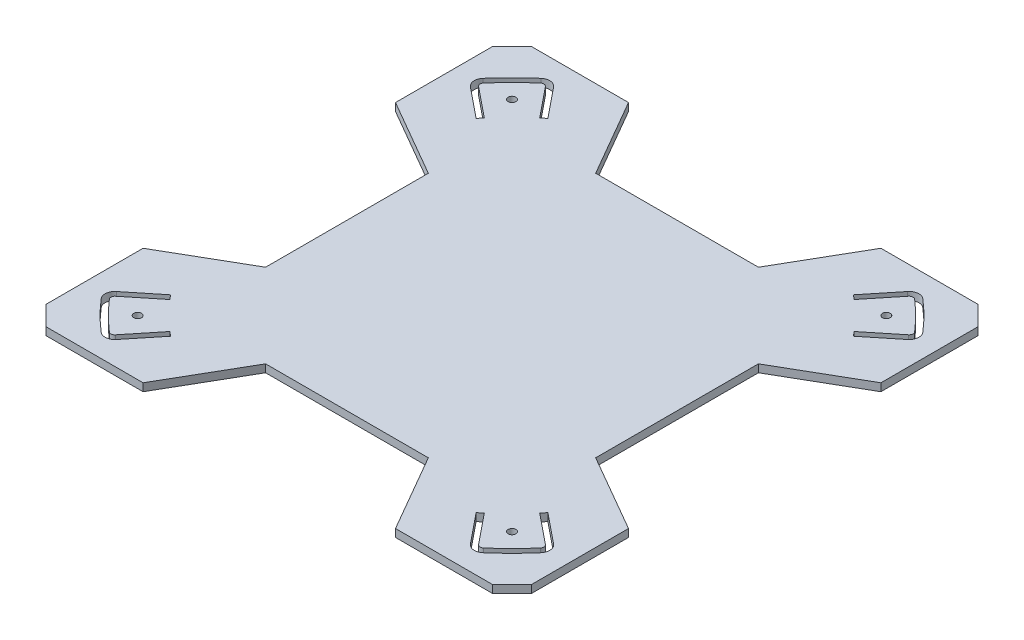
from build123d import *

# Parameters (mm, degrees)
BOSS_EXTRUDE1_DEPTH = 4
SKETCH7_R           = 2
CUT_EXTRUDE1_DEPTH  = 4


with BuildPart() as part:
    # Sketch1 → Boss-Extrude1 (new body)
    with BuildSketch(Plane(origin=(0, 0, 0), x_dir=(1, 0, 0), z_dir=(0, 1, 0))):
        Polygon((-125, 115), (-125, 65), (-85, 41.905989232), (-85, -41.905989232), (-125, -65), (-125, -115), (-115, -125), (-65, -125), (-41.905989232, -85), (41.905989232, -85), (65, -125), (115, -125), (125, -115), (125, -65), (85, -41.905989232), (85, 41.905989232), (125, 65), (125, 115), (115, 125), (65, 125), (41.905989232, 85), (-41.905989232, 85), (-65, 125), (-115, 125), align=None)
    extrude(amount=BOSS_EXTRUDE1_DEPTH)

    # Sketch7 → Cut-Extrude1 (cut)
    with BuildSketch(Plane.XZ):
        with Locations(Location((96.392180149, -96.396634108, 0), (0, 0, 270))):
            Circle(SKETCH7_R)
        with Locations(Location((-96.396634108, -96.392180149, 0), (0, 0, 270))):
            Circle(SKETCH7_R)
        with Locations(Location((-96.392180149, 96.396634108, 0), (0, 0, 270))):
            Circle(SKETCH7_R)
        with Locations(Location((96.396634108, 96.392180149, 0), (0, 0, 270))):
            Circle(SKETCH7_R)
        with BuildLine():
            Line((112.617319154, -91.199448609), (97.141666667, -78.666998145))
            Line((97.141666667, -78.666998145), (95.253658711, -80.998398145))
            Line((95.253658711, -80.998398145), (110.729311198, -93.530848609))
            ThreePointArc((110.729311198, -93.530848609), (111.462995743, -94.910428371), (110.980579079, -96.396634108))
            ThreePointArc((110.980579079, -96.396634108), (103.942611055, -103.946782572), (96.392180149, -110.984447587))
            ThreePointArc((96.392180149, -110.984447587), (94.905955053, -111.466804606), (93.526404737, -110.733064696))
            Line((93.526404737, -110.733064696), (80.994575353, -95.256909268))
            Line((80.994575353, -95.256909268), (78.663099585, -97.144823658))
            Line((78.663099585, -97.144823658), (91.194928969, -112.620979086))
            ThreePointArc((91.194928969, -112.620979086), (94.643804759, -114.455328861), (98.359367499, -113.249436313))
            ThreePointArc((98.359367499, -113.249436313), (106.063888832, -106.068145481), (113.245488856, -98.363912355))
            ThreePointArc((113.245488856, -98.363912355), (114.451530517, -94.648398013), (112.617319154, -91.199448609))
        make_face()
        with BuildLine():
            Line((-91.199448609, -112.617319154), (-78.666998145, -97.141666667))
            Line((-78.666998145, -97.141666667), (-80.998398145, -95.253658711))
            Line((-80.998398145, -95.253658711), (-93.530848609, -110.729311198))
            ThreePointArc((-93.530848609, -110.729311198), (-94.910428371, -111.462995743), (-96.396634108, -110.980579079))
            ThreePointArc((-96.396634108, -110.980579079), (-103.946782572, -103.942611055), (-110.984447587, -96.392180149))
            ThreePointArc((-110.984447587, -96.392180149), (-111.466804606, -94.905955053), (-110.733064696, -93.526404737))
            Line((-110.733064696, -93.526404737), (-95.256909268, -80.994575353))
            Line((-95.256909268, -80.994575353), (-97.144823658, -78.663099585))
            Line((-97.144823658, -78.663099585), (-112.620979086, -91.194928969))
            ThreePointArc((-112.620979086, -91.194928969), (-114.455328861, -94.643804759), (-113.249436313, -98.359367499))
            ThreePointArc((-113.249436313, -98.359367499), (-106.068145481, -106.063888832), (-98.363912355, -113.245488856))
            ThreePointArc((-98.363912355, -113.245488856), (-94.648398013, -114.451530517), (-91.199448609, -112.617319154))
        make_face()
        with BuildLine():
            Line((-112.617319154, 91.199448609), (-97.141666667, 78.666998145))
            Line((-97.141666667, 78.666998145), (-95.253658711, 80.998398145))
            Line((-95.253658711, 80.998398145), (-110.729311198, 93.530848609))
            ThreePointArc((-110.729311198, 93.530848609), (-111.462995743, 94.910428371), (-110.980579079, 96.396634108))
            ThreePointArc((-110.980579079, 96.396634108), (-103.942611055, 103.946782572), (-96.392180149, 110.984447587))
            ThreePointArc((-96.392180149, 110.984447587), (-94.905955053, 111.466804606), (-93.526404737, 110.733064696))
            Line((-93.526404737, 110.733064696), (-80.994575353, 95.256909268))
            Line((-80.994575353, 95.256909268), (-78.663099585, 97.144823658))
            Line((-78.663099585, 97.144823658), (-91.194928969, 112.620979086))
            ThreePointArc((-91.194928969, 112.620979086), (-94.643804759, 114.455328861), (-98.359367499, 113.249436313))
            ThreePointArc((-98.359367499, 113.249436313), (-106.063888832, 106.068145481), (-113.245488856, 98.363912355))
            ThreePointArc((-113.245488856, 98.363912355), (-114.451530517, 94.648398013), (-112.617319154, 91.199448609))
        make_face()
        with BuildLine():
            Line((91.199448609, 112.617319154), (78.666998145, 97.141666667))
            Line((78.666998145, 97.141666667), (80.998398145, 95.253658711))
            Line((80.998398145, 95.253658711), (93.530848609, 110.729311198))
            ThreePointArc((93.530848609, 110.729311198), (94.910428371, 111.462995743), (96.396634108, 110.980579079))
            ThreePointArc((96.396634108, 110.980579079), (103.946782572, 103.942611055), (110.984447587, 96.392180149))
            ThreePointArc((110.984447587, 96.392180149), (111.466804606, 94.905955053), (110.733064696, 93.526404737))
            Line((110.733064696, 93.526404737), (95.256909268, 80.994575353))
            Line((95.256909268, 80.994575353), (97.144823658, 78.663099585))
            Line((97.144823658, 78.663099585), (112.620979086, 91.194928969))
            ThreePointArc((112.620979086, 91.194928969), (114.455328861, 94.643804759), (113.249436313, 98.359367499))
            ThreePointArc((113.249436313, 98.359367499), (106.068145481, 106.063888832), (98.363912355, 113.245488856))
            ThreePointArc((98.363912355, 113.245488856), (94.648398013, 114.451530517), (91.199448609, 112.617319154))
        make_face()
    extrude(amount=-CUT_EXTRUDE1_DEPTH, mode=Mode.SUBTRACT)


solid = part.part
